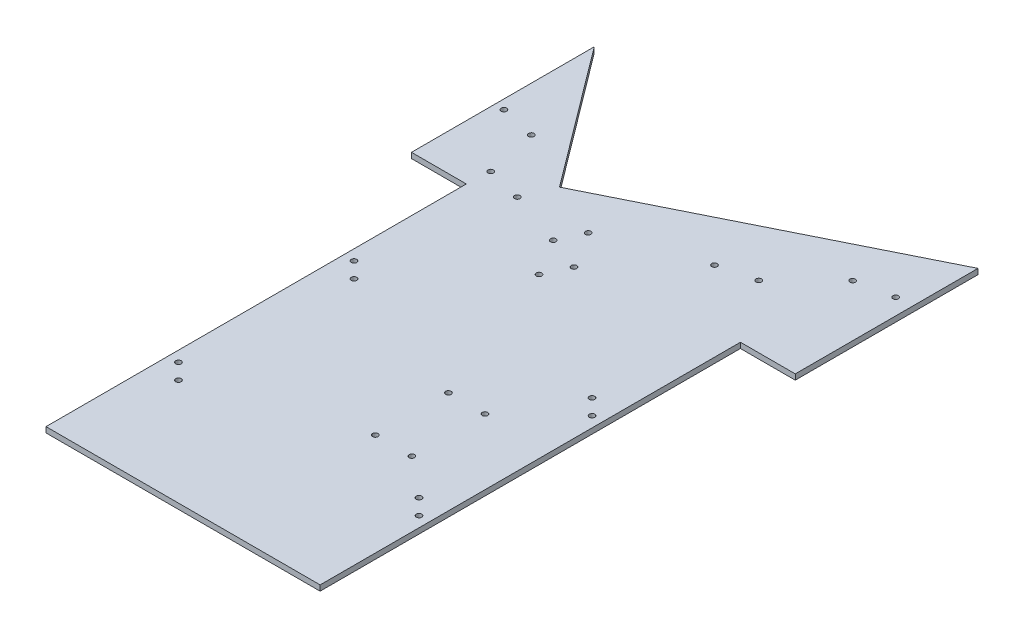
from build123d import *

# Parameters (mm, degrees)
SKETCH1_W           = 150
SKETCH1_H           = 200
SKETCH1_R           = 1.5
BOSS_EXTRUDE1_DEPTH = 3
SKETCH2_R           = 1.5
SKETCH2_R_2         = 1.500000003
SKETCH2_R_3         = 1.500000002
SKETCH2_R_4         = 1.499999997
SKETCH2_R_5         = 1.499999998
BOSS_EXTRUDE3_DEPTH = 3


with BuildPart() as part:
    # Sketch1 → Boss-Extrude1 (new body)
    with BuildSketch(Plane(origin=(0, 0, 0), x_dir=(1, 0, 0), z_dir=(0, 1, 0))):
        Rectangle(SKETCH1_W, SKETCH1_H)
        with Locations((-69.242640687, 62.79605759)):
            Circle(SKETCH1_R, mode=Mode.SUBTRACT)
        with Locations((-60.757359313, 54.310776216)):
            Circle(SKETCH1_R, mode=Mode.SUBTRACT)
        with Locations((60.757359313, 63.034810844)):
            Circle(SKETCH1_R, mode=Mode.SUBTRACT)
        with Locations((69.242640687, 54.54952947)):
            Circle(SKETCH1_R, mode=Mode.SUBTRACT)
        with Locations((-69.242640687, -33.274226936)):
            Circle(SKETCH1_R, mode=Mode.SUBTRACT)
        with Locations((-60.757359313, -41.75950831)):
            Circle(SKETCH1_R, mode=Mode.SUBTRACT)
        with Locations((60.757359313, -31.641853854)):
            Circle(SKETCH1_R, mode=Mode.SUBTRACT)
        with Locations((69.242640687, -40.127135228)):
            Circle(SKETCH1_R, mode=Mode.SUBTRACT)
        with Locations((19.1, 26.102840582)):
            Circle(SKETCH1_R, mode=Mode.SUBTRACT)
        with Locations((39.1, -13.897159418)):
            Circle(SKETCH1_R, mode=Mode.SUBTRACT)
        with Locations((19.1, -13.897159418)):
            Circle(SKETCH1_R, mode=Mode.SUBTRACT)
        with Locations((39.1, 26.102840582)):
            Circle(SKETCH1_R, mode=Mode.SUBTRACT)
    extrude(amount=BOSS_EXTRUDE1_DEPTH)

    # Sketch2 → Boss-Extrude3 (add)
    with BuildSketch(Plane(origin=(0, 3, 0), x_dir=(1, 0, 0), z_dir=(0, 1, 0))):
        Polygon((-75, 100), (-75, 130), (-105, 130), (-105, 230), (-48, 154), (105, 230), (105, 130), (75, 130), (75, 100), align=None)
        with Locations((-12.213557683, 106.98379185)):
            Circle(SKETCH2_R, mode=Mode.SUBTRACT)
        with Locations((-6.161864228, 120.074895942)):
            Circle(SKETCH2_R, mode=Mode.SUBTRACT)
        with Locations((-18.479232595, 140.175014292)):
            Circle(SKETCH2_R, mode=Mode.SUBTRACT)
        with Locations((-24.530926049, 127.0839102)):
            Circle(SKETCH2_R, mode=Mode.SUBTRACT)
        with Locations((31.340042848, 159.444468607)):
            Circle(SKETCH2_R_2, mode=Mode.SUBTRACT)
        with Locations((50.742574777, 164.296453223)):
            Circle(SKETCH2_R_2, mode=Mode.SUBTRACT)
        with Locations((76.536595955, 189.883247415)):
            Circle(SKETCH2_R_3, mode=Mode.SUBTRACT)
        with Locations((96.155699062, 193.767934439)):
            Circle(SKETCH2_R_3, mode=Mode.SUBTRACT)
        with Locations((-54.819560494, 137.744411735)):
            Circle(SKETCH2_R_4, mode=Mode.SUBTRACT)
        with Locations((-74.222092424, 142.596396351)):
            Circle(SKETCH2_R_4, mode=Mode.SUBTRACT)
        with Locations((-80.424369554, 170.997069146)):
            Circle(SKETCH2_R_5, mode=Mode.SUBTRACT)
        with Locations((-99.915689565, 175.479082556)):
            Circle(SKETCH2_R_5, mode=Mode.SUBTRACT)
    extrude(amount=-BOSS_EXTRUDE3_DEPTH)


solid = part.part
